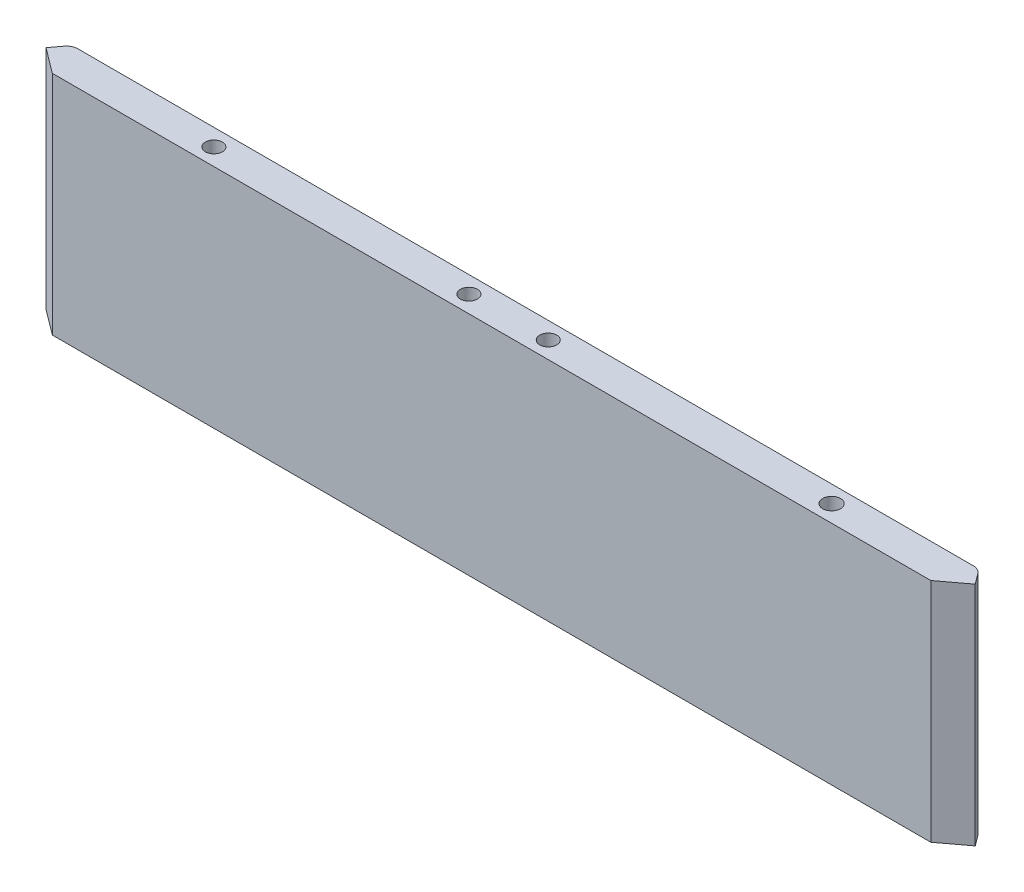
from build123d import *

# Parameters (mm, degrees)
BOSS_EXTRUDE1_DEPTH = 20
SKETCH2_R           = 1.5
SKETCH2_R_2         = 1.572515875
CUT_EXTRUDE1_DEPTH  = 5
FILLET1_R           = 2
SKETCH3_W           = 103.784472799
SKETCH3_H           = 73.748761466
CUT_EXTRUDE2_DEPTH  = 184.826439883


with BuildPart() as part:
    # Sketch1 → Boss-Extrude1 (new, symmetric)
    with BuildSketch(Plane(origin=(0, 0, 0), x_dir=(1, 0, 0), z_dir=(0, 1, 0))):
        Polygon((-110, 0), (-80, 40), (80, 40), (110, 0), (103, 0), (77.5, 34), (-77.5, 34), (-103, 0), align=None)
    extrude(amount=BOSS_EXTRUDE1_DEPTH, both=True)

    # Sketch2 → Cut-Extrude1 (cut)
    with BuildSketch(Plane(origin=(0, 20, 0), x_dir=(1, 0, 0), z_dir=(0, 1, 0))):
        with Locations((-104, 3)):
            Circle(SKETCH2_R)
        with Locations((-52, 37)):
            Circle(SKETCH2_R)
        with Locations((-7, 37)):
            Circle(SKETCH2_R)
        with Locations((7, 37)):
            Circle(SKETCH2_R)
        with Locations((104, 3)):
            Circle(SKETCH2_R)
        with Locations((57, 37)):
            Circle(SKETCH2_R_2)
    extrude(amount=-CUT_EXTRUDE1_DEPTH, mode=Mode.SUBTRACT)

    # Fillet1
    fillet1_edges = [part.edges().sort_by_distance(p)[0] for p in [
        (80, 0, -40),
        (-80, 0, -40),
    ]]
    fillet(fillet1_edges, radius=FILLET1_R)

    # Sketch3 → Cut-Extrude2 (cut, symmetric)
    with BuildSketch(Plane(origin=(-65.92, 0, -49.44), x_dir=(0.5999999999999999, 0, -0.8000000000000002), z_dir=(0.8000000000000003, 0, 0.5999999999999999))):
        with Locations((-71.1922364, 16.874380733)):
            Rectangle(SKETCH3_W, SKETCH3_H)
    cut_extrude2 = extrude(amount=CUT_EXTRUDE2_DEPTH, both=True, mode=Mode.SUBTRACT)

    # Mirror1: Cut-Extrude2 across plane
    add(cut_extrude2.mirror(Plane(origin=(0, 0, 0), x_dir=(0, 0, 1), z_dir=(1, 0, 0))), mode=Mode.SUBTRACT)


solid = part.part
